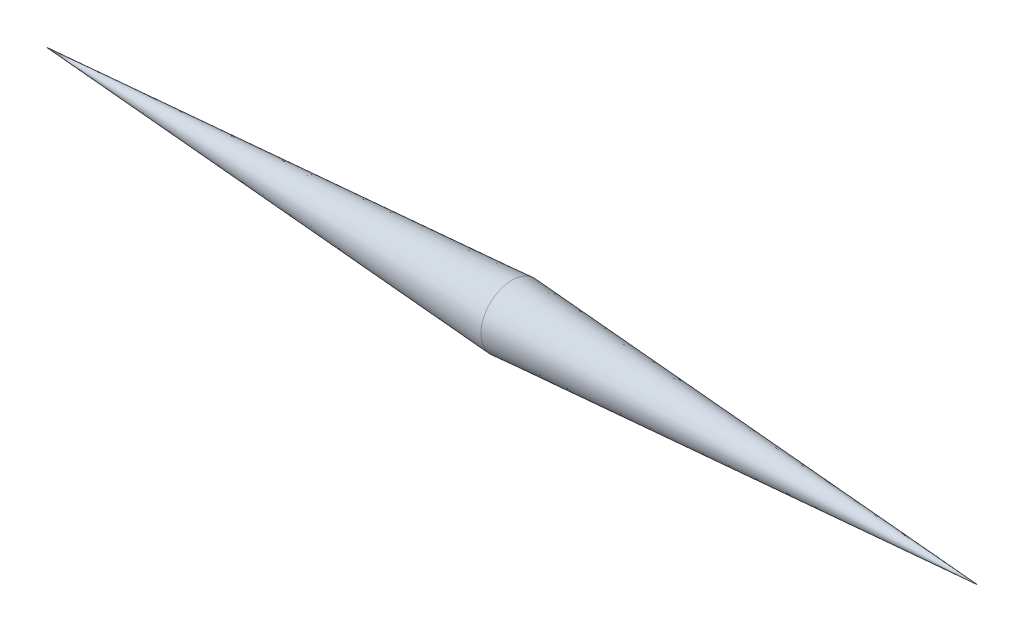
from build123d import *


with BuildPart() as part:
    # Croquis1 → Revolución1 (revolve)
    with BuildSketch(Plane.XY):
        Polygon((0, 0), (150, 0), (75, 5), align=None)
    revolve(axis=Axis((0, 0, 0), (1, 0, 0)))


solid = part.part
